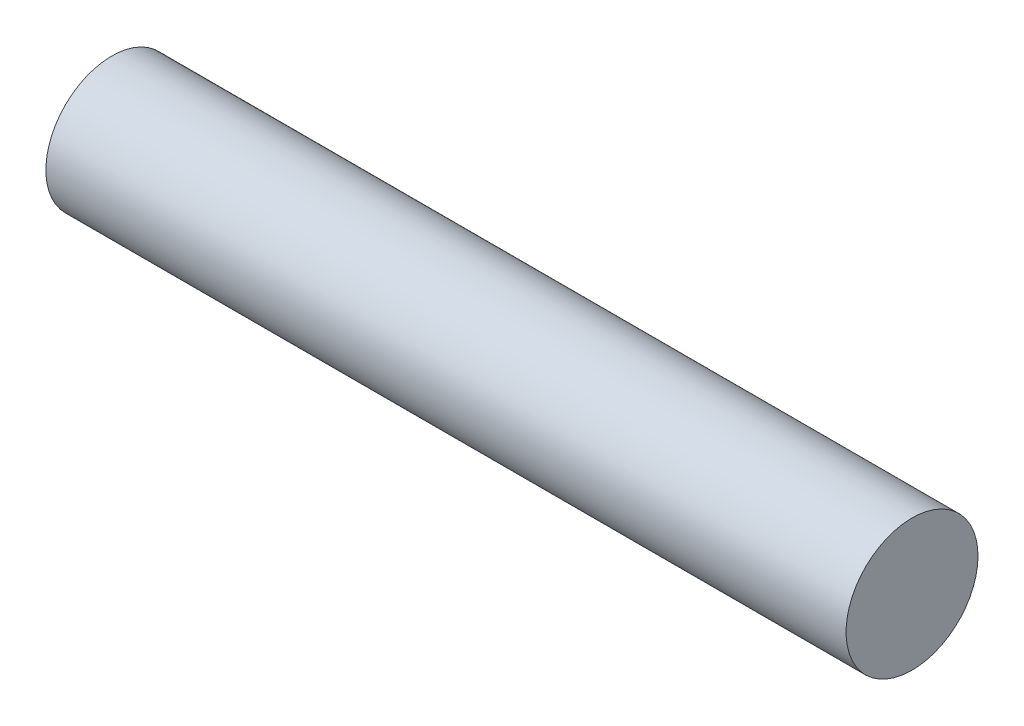
from build123d import *

# Parameters (mm, degrees)
HAND_START                 = -9.09921875
HAND_MASTERMODEL_OUTLINE_R = 1.5
HAND_MASTERMODEL_DEPTH     = 18.1984375
SKETCH23_R                 = 1.5
BOSS_EXTRUDE2_DEPTH        = 9.099219


# Read off the part's stored shape, not the designer's step: hand mastermodel
with BuildPart() as part:
    # hand mastermodel outline → hand mastermodel (new body)
    with BuildSketch(Plane.YZ.offset(HAND_START)):
        with Locations((0, 43)):
            Circle(HAND_MASTERMODEL_OUTLINE_R)
    extrude(amount=HAND_MASTERMODEL_DEPTH)

    # Sketch23 → Boss-Extrude2 (add)
    with BuildSketch(Plane(origin=(0, 0, 0), x_dir=(0, 0, -1), z_dir=(1, 0, 0))):
        with Locations((-43, 0)):
            Circle(SKETCH23_R)
    extrude(amount=BOSS_EXTRUDE2_DEPTH)


solid = part.part
